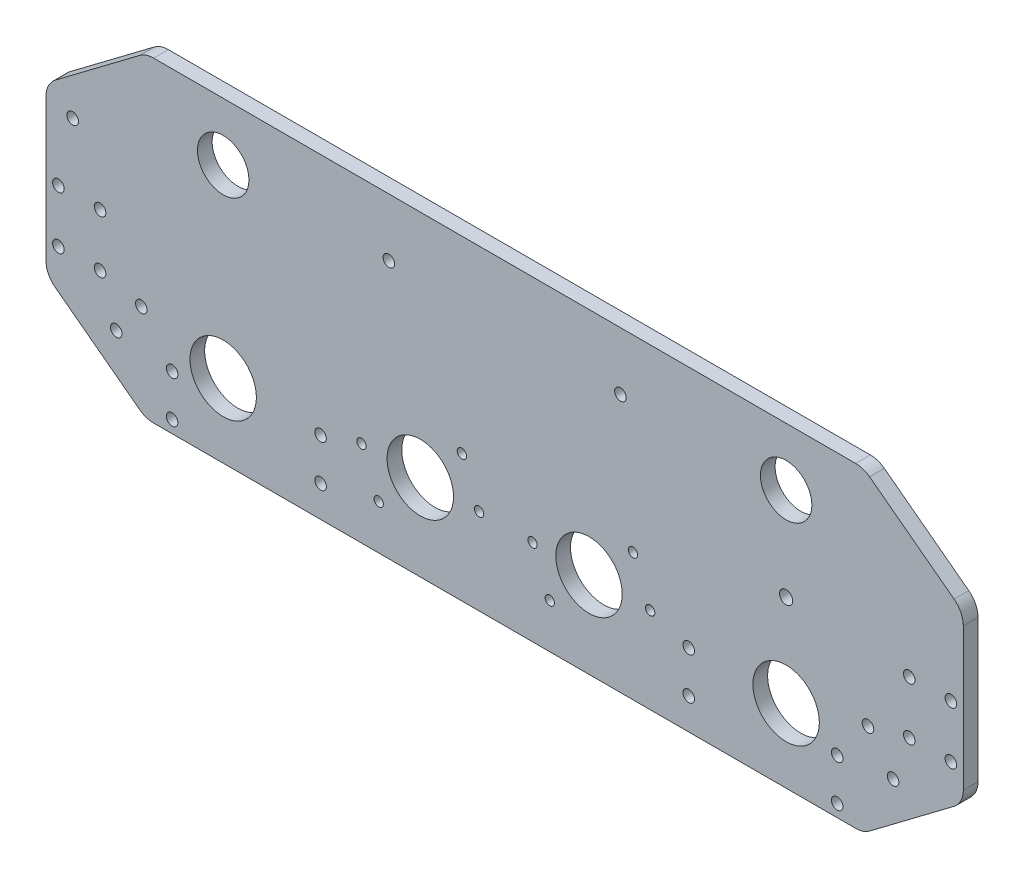
from build123d import *

# Parameters (mm, degrees)
SALIENTE_EXTRUIR1_DEPTH    = 6.35
REDONDEO1_R                = 10
CROQUIS2_R                 = 14.345
CORTAR_EXTRUIR1_DEPTH      = 10
CORTAR_EXTRUIR2_DEPTH      = 241.691916085
CORTAR_EXTRUIR2_DEPTH_BACK = 241.691916085
CROQUIS8_R                 = 14.345
CROQUIS8_R_2               = 2.01
CROQUIS8_R_3               = 2.02
CHAFL_N3_SIZE              = 1
CROQUIS9_R                 = 11.1125
CORTAR_EXTRUIR3_DEPTH      = 10
CROQUIS10_R                = 2.5
CROQUIS10_R_2              = 2.843216267
CORTAR_EXTRUIR4_DEPTH      = 10
CROQUIS11_R                = 2.5
CORTAR_EXTRUIR5_DEPTH      = 10


with BuildPart() as part:
    # Croquis1 → Saliente-Extruir1 (new body)
    with BuildSketch(Plane.XY):
        Polygon((155, 0), (198.126317543, 32.49801125), (198.126317543, 104.023922026), (155, 136.521933277), (-155, 136.521933277), (-198.126317543, 104.023922026), (-198.126317543, 32.49801125), (-155, 0), align=None)
    extrude(amount=SALIENTE_EXTRUIR1_DEPTH)

    # Redondeo1
    redondeo1_edges = [part.edges().sort_by_distance(p)[0] for p in [
        (-198.126317543, 32.49801125, 3.175),
        (198.126317543, 32.49801125, 3.175),
        (155, 0, 3.175),
        (-155, 0, 3.175),
        (155, 136.521933277, 3.175),
        (198.126317543, 104.023922026, 3.175),
        (-155, 136.521933277, 3.175),
        (-198.126317543, 104.023922026, 3.175),
    ]]
    fillet(redondeo1_edges, radius=REDONDEO1_R)

    # Croquis2 → Cortar-Extruir1 (cut)
    with BuildSketch(Plane.XY.offset(6.35)):
        with Locations((-121.592420883, 31.75)):
            Circle(CROQUIS2_R)
        with Locations((121.592420883, 31.75)):
            Circle(CROQUIS2_R)
    extrude(amount=-CORTAR_EXTRUIR1_DEPTH, mode=Mode.SUBTRACT)

    # Croquis8 → Cortar-Extruir2 (cut, two sides: drawn at the far end of the back side and taken through both)
    with BuildSketch(Plane.XY.offset(6.35).offset(-CORTAR_EXTRUIR2_DEPTH_BACK)):
        with Locations((-36.442420883, 37.2)):
            Circle(CROQUIS8_R)
        with Locations((36.442420883, 37.2)):
            Circle(CROQUIS8_R)
        with Locations((12.057209477, 37.2)):
            Circle(CROQUIS8_R_2)
        with Locations((19.496697235, 19.239487758)):
            Circle(CROQUIS8_R_2)
        with Locations((62.857209477, 37.2)):
            Circle(CROQUIS8_R_2)
        with Locations((55.417721719, 55.160512242)):
            Circle(CROQUIS8_R_2)
        with Locations((-18.48190864, 55.160512242)):
            Circle(CROQUIS8_R_3)
        with Locations((-11.042420883, 37.2)):
            Circle(CROQUIS8_R_3)
        with Locations((-54.402933125, 19.239487758)):
            Circle(CROQUIS8_R_3)
        with Locations((-61.842420883, 37.2)):
            Circle(CROQUIS8_R_3)
        with Locations((-121.592420883, 31.75)):
            Circle(CROQUIS8_R)
    extrude(amount=CORTAR_EXTRUIR2_DEPTH + CORTAR_EXTRUIR2_DEPTH_BACK, mode=Mode.SUBTRACT)

    # Chaflán3
    chafl_n3_edges = [part.edges().sort_by_distance(p)[0] for p in [
        (-56.422933125, 19.239487758, 0),
        (-63.862420883, 37.2, 0),
        (-20.50190864, 55.160512242, 0),
        (-13.062420883, 37.2, 0),
        (10.047209477, 37.2, 0),
        (17.486697235, 19.239487758, 0),
        (53.407721719, 55.160512242, 0),
        (60.847209477, 37.2, 0),
    ]]
    chamfer(chafl_n3_edges, length=CHAFL_N3_SIZE)

    # Croquis9 → Cortar-Extruir3 (cut)
    with BuildSketch(Plane(origin=(0, 0, 0), x_dir=(-1, 0, 0), z_dir=(0, 0, -1))):
        with Locations((-121.592420883, 111.521933277)):
            Circle(CROQUIS9_R)
        with Locations((121.592420883, 111.521933277)):
            Circle(CROQUIS9_R)
    extrude(amount=-CORTAR_EXTRUIR3_DEPTH, mode=Mode.SUBTRACT)

    # Croquis10 → Cortar-Extruir4 (cut)
    with BuildSketch(Plane(origin=(0, 0, 0), x_dir=(-1, 0, 0), z_dir=(0, 0, -1))):
        with Locations((-50, 111.521933277)):
            Circle(CROQUIS10_R)
        with Locations((50, 111.521933277)):
            Circle(CROQUIS10_R)
        with Locations((-121.592420883, 71.461933277)):
            Circle(CROQUIS10_R_2)
        with Locations((186.592420883, 96.521933277)):
            Circle(CROQUIS10_R)
    extrude(amount=-CORTAR_EXTRUIR4_DEPTH, mode=Mode.SUBTRACT)

    # Croquis11 → Cortar-Extruir5 (cut)
    with BuildSketch(Plane.XY.offset(6.35)):
        with Locations((-143.654046805, 23.35)):
            Circle(CROQUIS11_R)
        with Locations((-143.654046805, 5.35)):
            Circle(CROQUIS11_R)
        with Locations((-79.522420883, 31.5)):
            Circle(CROQUIS11_R)
        with Locations((-79.522420883, 13.5)):
            Circle(CROQUIS11_R)
        with Locations((143.654046805, 5.35)):
            Circle(CROQUIS11_R)
        with Locations((143.654046805, 23.35)):
            Circle(CROQUIS11_R)
        with Locations((79.522420883, 13.5)):
            Circle(CROQUIS11_R)
        with Locations((79.522420883, 31.5)):
            Circle(CROQUIS11_R)
        with Locations((-174.776317543, 45.483827331)):
            Circle(CROQUIS11_R)
        with Locations((-192.776317543, 45.483827331)):
            Circle(CROQUIS11_R)
        with Locations((-174.776317543, 68.260966638)):
            Circle(CROQUIS11_R)
        with Locations((-192.776317543, 68.260966638)):
            Circle(CROQUIS11_R)
        with Locations((174.776317543, 45.483827331)):
            Circle(CROQUIS11_R)
        with Locations((192.776317543, 45.483827331)):
            Circle(CROQUIS11_R)
        with Locations((192.776317543, 68.260966638)):
            Circle(CROQUIS11_R)
        with Locations((174.776317543, 68.260966638)):
            Circle(CROQUIS11_R)
        with Locations((-156.951159176, 40.912577131)):
            Circle(CROQUIS11_R)
        with Locations((-167.783829593, 26.537137951)):
            Circle(CROQUIS11_R)
        with Locations((167.783829593, 26.537137951)):
            Circle(CROQUIS11_R)
        with Locations((156.951159176, 40.912577131)):
            Circle(CROQUIS11_R)
    extrude(amount=-CORTAR_EXTRUIR5_DEPTH, mode=Mode.SUBTRACT)


solid = part.part
